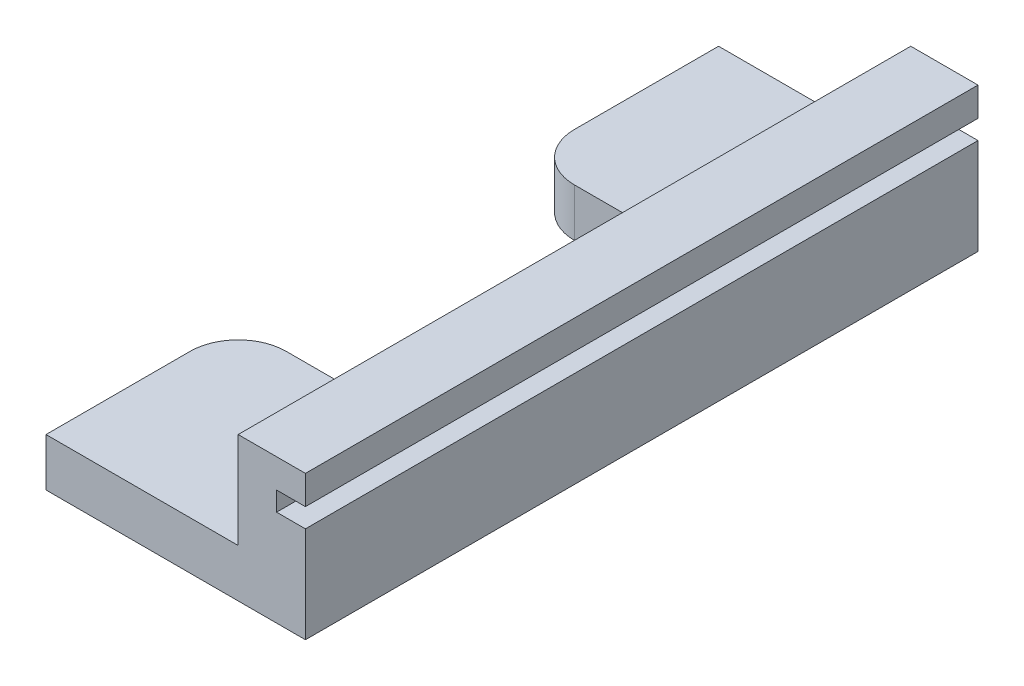
from build123d import *

# Parameters (mm, degrees)
SKETCH4_W           = 20
SKETCH4_H           = 70
BOSS_EXTRUDE2_DEPTH = 5
SKETCH5_W           = 7
SKETCH5_H           = 70
BOSS_EXTRUDE3_DEPTH = 10
SKETCH6_W           = 70
SKETCH6_H           = 1.998143523
CUT_EXTRUDE1_DEPTH  = 3
SKETCH8_W           = 10
SKETCH8_H           = 30
CUT_EXTRUDE2_DEPTH  = 74.484692283
FILLET3_START       = -1
FILLET3_DEPTH       = 6
FILLET3_2_DEPTH     = 5
FILLET4_R           = 5
SKETCH10_W          = 13.639904779
SKETCH10_H          = 5
CUT_EXTRUDE3_DEPTH  = 75.330343737
SKETCH11_W          = 70
SKETCH11_H          = 5
BOSS_EXTRUDE4_DEPTH = 20
SKETCH13_W          = 15
SKETCH13_H          = 30
CUT_EXTRUDE4_DEPTH  = 20
FILLET6_R           = 5


with BuildPart() as part:
    # Sketch4 → Boss-Extrude2 (new body)
    with BuildSketch(Plane(origin=(0, 0, 0), x_dir=(1, 0, 0), z_dir=(0, 1, 0))):
        with Locations((10, 35)):
            Rectangle(SKETCH4_W, SKETCH4_H)
    extrude(amount=BOSS_EXTRUDE2_DEPTH)

    # Sketch5 → Boss-Extrude3 (add)
    with BuildSketch(Plane(origin=(0, 5, 0), x_dir=(1, 0, 0), z_dir=(0, 1, 0))):
        with Locations((3.5, 35)):
            Rectangle(SKETCH5_W, SKETCH5_H)
    extrude(amount=BOSS_EXTRUDE3_DEPTH)

    # Sketch6 → Cut-Extrude1 (cut)
    with BuildSketch(Plane(origin=(7, 0, 0), x_dir=(0, 0, -1), z_dir=(1, 0, 0))):
        with Locations((35, 10.999071762)):
            Rectangle(SKETCH6_W, SKETCH6_H)
    extrude(amount=-CUT_EXTRUDE1_DEPTH, mode=Mode.SUBTRACT)

    # Sketch8 → Cut-Extrude2 (cut, through all)
    with BuildSketch(Plane(origin=(0, 5, 0), x_dir=(1, 0, 0), z_dir=(0, 1, 0))):
        with Locations((15, 35)):
            Rectangle(SKETCH8_W, SKETCH8_H)
    extrude(amount=-CUT_EXTRUDE2_DEPTH, mode=Mode.SUBTRACT)

    # Fillet3: read off the stored shape, not the designer's step
    # Fillet3 outline → Fillet3 (cut)
    with BuildSketch(Plane(origin=(0, 0, 0), x_dir=(1, 0, 0), z_dir=(0, 1, 0)).offset(FILLET3_START)):
        with BuildLine():
            Line((20, 50), (20, 55))
            ThreePointArc((20, 55), (18.535533906, 51.464466094), (15, 50))
            Line((15, 50), (20, 50))
        make_face()
        with BuildLine():
            Line((20, 20), (15, 20))
            ThreePointArc((15, 20), (18.535533906, 18.535533906), (20, 15))
            Line((20, 15), (20, 20))
        make_face()
    extrude(amount=FILLET3_DEPTH, mode=Mode.SUBTRACT)

    # Fillet3 2 outline → Fillet3 2 (add)
    with BuildSketch(Plane(origin=(0, 0, 0), x_dir=(1, 0, 0), z_dir=(0, 1, 0))):
        with BuildLine():
            ThreePointArc((15, 20), (11.464466094, 21.464466094), (10, 25))
            Line((10, 25), (10, 20))
            Line((10, 20), (15, 20))
        make_face()
        with BuildLine():
            ThreePointArc((10, 45), (11.464466094, 48.535533906), (15, 50))
            Line((15, 50), (10, 50))
            Line((10, 50), (10, 45))
        make_face()
    extrude(amount=FILLET3_2_DEPTH)

    # Fillet4
    fillet4_edges = [part.edges().sort_by_distance(p)[0] for p in [
        (20, 2.5, -70),
        (20, 2.5, 0),
    ]]
    fillet(fillet4_edges, radius=FILLET4_R)

    # Sketch10 → Cut-Extrude3 (cut, through all)
    with BuildSketch(Plane(origin=(0, 0, -70), x_dir=(-1, 0, 0), z_dir=(0, 0, -1))):
        with Locations((-13.81995239, 2.5)):
            Rectangle(SKETCH10_W, SKETCH10_H)
    extrude(amount=-CUT_EXTRUDE3_DEPTH, mode=Mode.SUBTRACT)

    # Sketch11 → Boss-Extrude4 (add)
    with BuildSketch(Plane.ZY):
        with Locations((-35, 2.5)):
            Rectangle(SKETCH11_W, SKETCH11_H)
    extrude(amount=BOSS_EXTRUDE4_DEPTH)

    # Sketch13 → Cut-Extrude4 (cut)
    with BuildSketch(Plane(origin=(0, 5, 0), x_dir=(1, 0, 0), z_dir=(0, 1, 0))):
        with Locations((-12.5, 35)):
            Rectangle(SKETCH13_W, SKETCH13_H)
    extrude(amount=-CUT_EXTRUDE4_DEPTH, mode=Mode.SUBTRACT)

    # Fillet6
    fillet6_edges = [part.edges().sort_by_distance(p)[0] for p in [
        (-20, 2.5, -50),
        (-20, 2.5, -20),
        (-5, 2.5, -20),
        (-5, 2.5, -50),
    ]]
    fillet(fillet6_edges, radius=FILLET6_R)


solid = part.part
